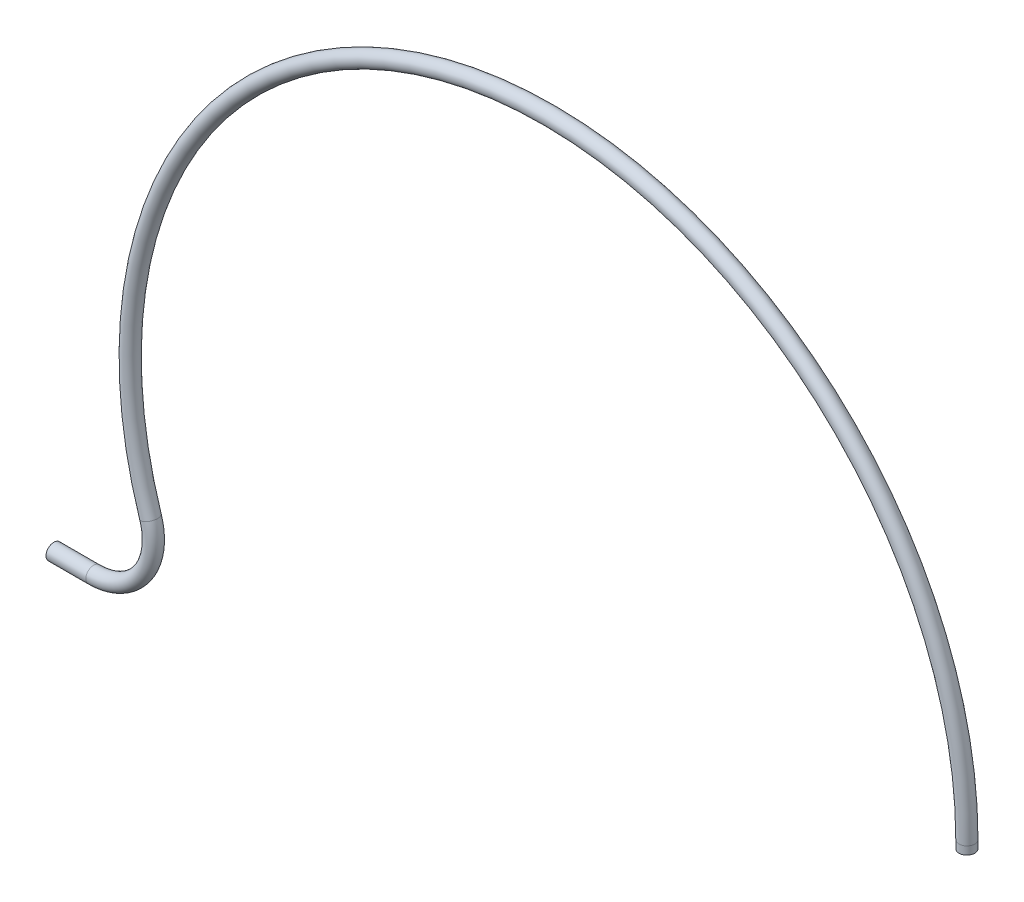
from build123d import *

# Parameters (mm, degrees)
SKETCH2_R   = 1.975
SKETCH2_R_2 = 0.95


with BuildPart() as part:
    # Sweep1: sweep along a path in Sketch1
    with BuildLine(Plane.XY) as sweep1_path:
        Line((-99.178047134, -43.105097392), (-89.178047134, -43.105097234))
        ThreePointArc((-89.178047134, -43.105097234), (-77.048381773, -36.929564146), (-74.906336339, -23.487926075))
        ThreePointArc((-74.906336339, -23.487926075), (8.714630076, 112.678398271), (130.189129821, 8.862793366))
        Line((130.189129821, 8.862793366), (130.189129821, 6.862793366))
    # Sketch2 → Sweep1 (sweep)
    with BuildSketch(Plane(origin=(-99.178047134, -43.105097392, 0), x_dir=(0, 0, -1), z_dir=(0.9999999999999999, 1.571203167571867e-08, 0))):
        Circle(SKETCH2_R)
        Circle(SKETCH2_R_2, mode=Mode.SUBTRACT)
    sweep(path=sweep1_path.line)


solid = part.part
